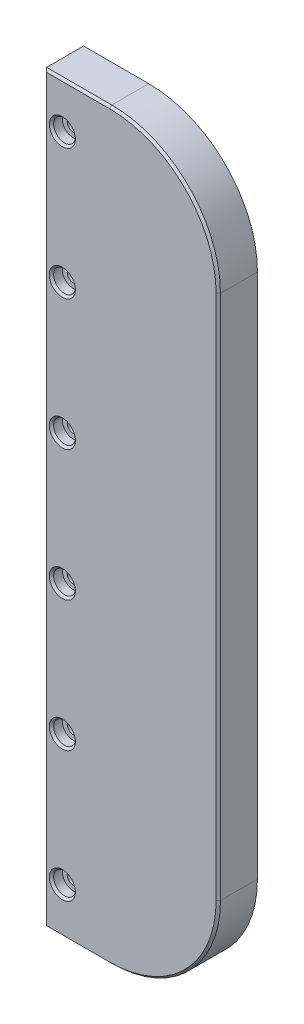
from build123d import *

# Parameters (mm, degrees)
SKETCH1_W                      = 80
SKETCH1_H                      = 342
BOSS_EXTRUDE1_DEPTH            = 18
FILLET1_R                      = 50
CBORE_FOR_M5_SHCS1_D           = 5.5
CBORE_FOR_M5_SHCS1_DEPTH       = 28.347633298
CBORE_FOR_M5_SHCS1_CBORE_D     = 10
CBORE_FOR_M5_SHCS1_CBORE_DEPTH = 5
CBORE_FOR_M5_SHCS1_TIP         = 1.652366702
CHAMFER1_SIZE                  = 1


with BuildPart() as part:
    # Sketch1 → Boss-Extrude1 (new body)
    with BuildSketch(Plane.XY):
        with Locations((41, 100)):
            Rectangle(SKETCH1_W, SKETCH1_H)
    extrude(amount=BOSS_EXTRUDE1_DEPTH)

    # Fillet1
    fillet1_edges = [part.edges().sort_by_distance(p)[0] for p in [
        (81, 271, 9),
        (81, -71, 9),
    ]]
    fillet(fillet1_edges, radius=FILLET1_R)

    # CBORE for M5 SHCS1
    with Locations(Plane.XY.offset(18)):
        with Locations((9.25, 250), (9.25, 190), (9.25, 130), (9.25, 70), (9.25, 10), (9.25, -50)):
            CounterBoreHole(CBORE_FOR_M5_SHCS1_D / 2, CBORE_FOR_M5_SHCS1_CBORE_D / 2, CBORE_FOR_M5_SHCS1_CBORE_DEPTH, depth=CBORE_FOR_M5_SHCS1_DEPTH)
            with Locations((0, 0, -(CBORE_FOR_M5_SHCS1_DEPTH + CBORE_FOR_M5_SHCS1_TIP / 2))):  # 118° drill point
                Cone(0, CBORE_FOR_M5_SHCS1_D / 2, CBORE_FOR_M5_SHCS1_TIP, mode=Mode.SUBTRACT)

    # Chamfer1
    chamfer1_edges = [part.edges().sort_by_distance(p)[0] for p in [
        (66.355339059, -56.355339059, 18),
        (16, -71, 18),
        (1, 100, 18),
        (16, 271, 18),
        (66.355339059, 256.355339059, 18),
        (81, 100, 18),
        (4.25, -50, 18),
        (4.25, 10, 18),
        (4.25, 70, 18),
        (4.25, 130, 18),
        (4.25, 190, 18),
        (4.25, 250, 18),
    ]]
    chamfer(chamfer1_edges, length=CHAMFER1_SIZE)


solid = part.part
